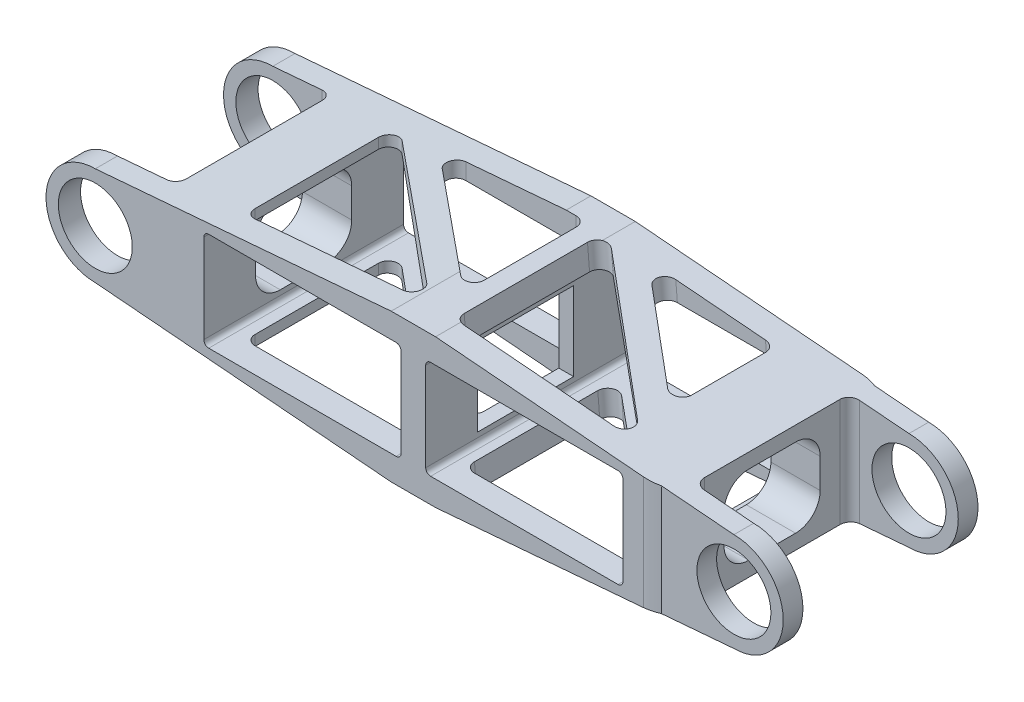
from build123d import *
from build123d.topology import SkipClean

# Parameters (mm, degrees)
ESQUISSE1_W                   = 150
ESQUISSE1_H                   = 30
BOSS_EXTRU_1_DEPTH            = 40.5
BOSS_EXTRU_2_DEPTH            = 40.5
ENL_V_MAT_EXTRU_2_DEPTH       = 173.526084984
ENL_V_START                   = -138
ESQUISSE4_W                   = 31.5
ESQUISSE4_H                   = 44.902895409
ENL_V_MAT_EXTRU_3_DEPTH       = 50
ENL_V_START_2                 = -50
ENL_V_MAT_EXTRU_4_DEPTH       = 50
ESQUISSE6_W                   = 40.808644438
ESQUISSE6_H                   = 31.212282358
ENL_V_MAT_EXTRU_5_DEPTH       = 0.5
ESQUISSE7_W                   = 30.686861219
ESQUISSE7_H                   = 47.66257168
ENL_V_MAT_EXTRU_6_DEPTH       = 0.5
ENL_V_MAT_EXTRU_7_DEPTH       = 168.750558866
CONG_1_R                      = 2
CONG_2_R                      = 10
ESQUISSE9_W                   = 19.5
ESQUISSE9_H                   = 16
ENL_V_MAT_EXTRU_8_DEPTH       = 147.915792208
ENL_V_MAT_EXTRU_9_DEPTH       = 169.654641001
CONG_4_R                      = 5
ENL_V_MAT_EXTRU_10_DEPTH      = 168.750558866
ENL_V_MAT_EXTRU_10_DEPTH_BACK = 168.750558866
ENL_V_MAT_EXTRU_11_DEPTH      = 168.750558866
ESQUISSE13_R                  = 7.5
ENL_V_MAT_EXTRU_12_DEPTH      = 168.750558908
ENL_V_MAT_EXTRU_13_DEPTH      = 168.750558908
ENL_V_START_3                 = -105
ESQUISSE15_W                  = 31.5
ESQUISSE15_H                  = 62.544521206
ENL_V_MAT_EXTRU_14_DEPTH      = 45
CONG_5_R                      = 2
CONG_6_R                      = 5


with BuildPart() as part:
    # Esquisse1 → Boss.-Extru.1 (new body)
    with BuildSketch(Plane.XY):
        with Locations((75, 15)):
            Rectangle(ESQUISSE1_W, ESQUISSE1_H)
    extrude(amount=BOSS_EXTRU_1_DEPTH)

    # Esquisse3 → Boss.-Extru.2 (add, through all)
    with BuildSketch(Plane.XY.offset(40.5)):
        with BuildLine():
            Line((150, 7.5), (150, 0))
            ThreePointArc((150, 0), (165, 15), (150, 30))
            Line((150, 30), (150, 22.5))
            ThreePointArc((150, 22.5), (155.303300859, 20.303300859), (157.5, 15))
            ThreePointArc((157.5, 15), (155.303300859, 9.696699141), (150, 7.5))
        make_face()
    extrude(amount=-BOSS_EXTRU_2_DEPTH)

    # Esquisse3<3> → Enlèv. mat.-Extru.2 (cut, through all)
    with SkipClean():  # the faces are left unmerged after this step: merging them gives an invalid solid
        with BuildSketch(Plane.XY.offset(40.5)):
            with BuildLine():
                Line((150, 22.5), (150, 7.5))
                ThreePointArc((150, 7.5), (155.303300859, 9.696699141), (157.5, 15))
                ThreePointArc((157.5, 15), (155.303300859, 20.303300859), (150, 22.5))
            make_face()
            with BuildLine():
                ThreePointArc((150, 22.5), (142.5, 15), (150, 7.5))
                Line((150, 7.5), (150, 22.5))
            make_face()
        extrude(amount=-ENL_V_MAT_EXTRU_2_DEPTH, mode=Mode.SUBTRACT)

    # Esquisse4 → Enlèv. mat.-Extru.3 (cut)
    with BuildSketch(Plane.ZY.offset(ENL_V_START)):
        with Locations((20.25, 16.046124804)):
            Rectangle(ESQUISSE4_W, ESQUISSE4_H)
    extrude(amount=-ENL_V_MAT_EXTRU_3_DEPTH, mode=Mode.SUBTRACT)

    # Esquisse5 → Enlèv. mat.-Extru.4 (cut)
    with BuildSketch(Plane(origin=(0, 0, 0), x_dir=(-1, 0, 0), z_dir=(0, 0, -1)).offset(ENL_V_START_2)):
        with BuildLine():
            Line((-90, 0), (-150, 5))
            ThreePointArc((-150, 5), (-160, 15), (-150, 25))
            Line((-150, 25), (-90, 30))
            Line((-90, 30), (-150, 30))
            ThreePointArc((-150, 30), (-165, 15), (-150, 0))
            Line((-150, 0), (-90, 0))
        make_face()
    extrude(amount=ENL_V_MAT_EXTRU_4_DEPTH, mode=Mode.SUBTRACT)

    # Esquisse6 → Enlèv. mat.-Extru.5 (cut)
    with BuildSketch(Plane(origin=(0, 0, 0), x_dir=(-1, 0, 0), z_dir=(0, 0, -1))):
        with Locations((-159.466318707, 17.991552194)):
            Rectangle(ESQUISSE6_W, ESQUISSE6_H)
    extrude(amount=-ENL_V_MAT_EXTRU_5_DEPTH, mode=Mode.SUBTRACT)

    # Esquisse7 → Enlèv. mat.-Extru.6 (cut)
    with BuildSketch(Plane.XY.offset(40.5)):
        with Locations((150.623308265, 11.626621639)):
            Rectangle(ESQUISSE7_W, ESQUISSE7_H)
    extrude(amount=-ENL_V_MAT_EXTRU_6_DEPTH, mode=Mode.SUBTRACT)

    # Esquisse8 → Enlèv. mat.-Extru.7 (cut, through all)
    with BuildSketch(Plane(origin=(0, 0, 0), x_dir=(-1, 0, 0), z_dir=(0, 0, -1))):
        with BuildLine():
            Line((-127, 5), (-89, 5))
            ThreePointArc((-89, 5), (-88.292893219, 5.292893219), (-88, 6))
            Line((-88, 6), (-88, 24))
            ThreePointArc((-88, 24), (-88.292893219, 24.707106781), (-89, 25))
            Line((-89, 25), (-127, 25))
            ThreePointArc((-127, 25), (-127.707106781, 24.707106781), (-128, 24))
            Line((-128, 24), (-128, 6))
            ThreePointArc((-128, 6), (-127.707106781, 5.292893219), (-127, 5))
        make_face()
    extrude(amount=-ENL_V_MAT_EXTRU_7_DEPTH, mode=Mode.SUBTRACT)

    # Congé1
    cong_1_edges = [part.edges().sort_by_distance(p)[0] for p in [
        (138, 15, 36),
        (138, 15, 4.5),
    ]]
    fillet(cong_1_edges, radius=CONG_1_R)

    # Congé2
    # the kernel refuses this fillet: 10 mm, written as the material it takes off along each edge
    with BuildSketch(Plane(origin=(139.061996488, -3.717747791, 0), x_dir=(-1, 0, 0), z_dir=(0, 1, 0))) as cong_2_piece_1:
        with BuildLine():
            CenterArc((3.122498999, 10), CONG_2_R, 251.805127661, 18.194872339)
            Line((0, 0.5), (-0.06244998, 0.31))
            ThreePointArc((-0.06244998, 0.31), (-0.2, 0.25), (-0.2, 0))
            Line((-0.2, 0), (0, -0.2))
            Line((0, -0.2), (3.122498999, -0.2))
            Line((3.122498999, -0.2), (3.122498999, 0))
        make_face()
    extrude(amount=37.435495581, mode=Mode.SUBTRACT)
    with BuildSketch(Plane(origin=(135.279877656, 34.03292436, 40.5), x_dir=(-2.2168933355567372e-12, 0, -1.0), z_dir=(0, -1, 0))) as cong_2_piece_2:
        with BuildLine():
            CenterArc((10, -3.122498999), CONG_2_R, 161.805127661, 18.194872339)
            Line((0, -3.122498999), (-0.2, -3.122498999))
            Line((-0.2, -3.122498999), (-0.2, 0))
            Line((-0.2, 0), (0, 0.2))
            ThreePointArc((0, 0.2), (0.25, 0.2), (0.31, 0.06244998))
            Line((0.31, 0.06244998), (0.5, 0))
        make_face()
    extrude(amount=38.06584872, mode=Mode.SUBTRACT)

    # Esquisse9 → Enlèv. mat.-Extru.8 (cut, through all)
    with BuildSketch(Plane(origin=(138, 0, 0), x_dir=(0, 0, -1), z_dir=(1, 0, 0))):
        with Locations((-20.25, 15)):
            Rectangle(ESQUISSE9_W, ESQUISSE9_H)
    extrude(amount=-ENL_V_MAT_EXTRU_8_DEPTH, mode=Mode.SUBTRACT)

    # Esquisse10 → Enlèv. mat.-Extru.9 (cut, through all)
    with BuildSketch(Plane(origin=(0.620689655, -7.448275862, 0), x_dir=(0.9965457582448797, 0.08304547985373982, 0), z_dir=(0.08304547985373982, -0.9965457582448797, 0))):
        with BuildLine():
            Line((121.973972493, 23.536442559), (103.973972493, 8.536442559))
            ThreePointArc((103.973972493, 8.536442559), (103.373798137, 6.319149472), (105.254341292, 5))
            Line((105.254341292, 5), (123.254341292, 5))
            ThreePointArc((123.254341292, 5), (124.668554855, 5.585786438), (125.254341292, 7))
            Line((125.254341292, 7), (125.254341292, 22))
            ThreePointArc((125.254341292, 22), (124.102652085, 23.811178842), (121.973972493, 23.536442559))
        make_face()
        with BuildLine():
            Line((124.276260675, 31.963557441), (94.276260675, 6.963557441))
            ThreePointArc((94.276260675, 6.963557441), (92.147581083, 6.688821158), (90.995891876, 8.5))
            Line((90.995891876, 8.5), (90.995891876, 33.5))
            ThreePointArc((90.995891876, 33.5), (91.581678313, 34.914213562), (92.995891876, 35.5))
            Line((92.995891876, 35.5), (122.995891876, 35.5))
            ThreePointArc((122.995891876, 35.5), (124.876435031, 34.180850528), (124.276260675, 31.963557441))
        make_face()
    extrude(amount=-ENL_V_MAT_EXTRU_9_DEPTH, mode=Mode.SUBTRACT)

    # Congé4
    cong_4_edges = [part.edges().sort_by_distance(p)[0] for p in [
        (133, 23, 10.5),
        (133, 7, 10.5),
        (133, 7, 30),
        (133, 23, 30),
    ]]
    fillet(cong_4_edges, radius=CONG_4_R)

    # Esquisse11 → Enlèv. mat.-Extru.10 (cut, two sides: drawn at the far end of the back side and taken through both)
    with BuildSketch(Plane(origin=(0, 0, 0), x_dir=(-1, 0, 0), z_dir=(0, 0, -1)).offset(-ENL_V_MAT_EXTRU_10_DEPTH_BACK)):
        with BuildLine():
            Line((-82, 5), (-44, 5))
            ThreePointArc((-44, 5), (-43.292893219, 5.292893219), (-43, 6))
            Line((-43, 6), (-43, 24))
            ThreePointArc((-43, 24), (-43.292893219, 24.707106781), (-44, 25))
            Line((-44, 25), (-82, 25))
            ThreePointArc((-82, 25), (-82.707106781, 24.707106781), (-83, 24))
            Line((-83, 24), (-83, 6))
            ThreePointArc((-83, 6), (-82.707106781, 5.292893219), (-82, 5))
        make_face()
    extrude(amount=ENL_V_MAT_EXTRU_10_DEPTH + ENL_V_MAT_EXTRU_10_DEPTH_BACK, mode=Mode.SUBTRACT)

    # Esquisse12 → Enlèv. mat.-Extru.11 (cut, through all)
    with BuildSketch(Plane.XZ):
        with BuildLine():
            Line((81.75012438, 27.165281701), (59.356069146, 8.503569006))
            ThreePointArc((59.356069146, 8.503569006), (58.761473804, 6.306887113), (60.624536078, 5))
            Line((60.624536078, 5), (83.018591312, 5))
            ThreePointArc((83.018591312, 5), (84.419658831, 5.580341169), (85, 6.981408688))
            Line((85, 6.981408688), (85, 25.643121383))
            ThreePointArc((85, 25.643121383), (83.859016499, 27.437464131), (81.75012438, 27.165281701))
        make_face()
        with BuildLine():
            Line((79.569697683, 31.85680085), (49.569697683, 6.85680085))
            ThreePointArc((49.569697683, 6.85680085), (47.441018091, 6.582064567), (46.289328883, 8.393243409))
            Line((46.289328883, 8.393243409), (46.289328883, 33.393243409))
            ThreePointArc((46.289328883, 33.393243409), (46.875115321, 34.807456972), (48.289328883, 35.393243409))
            Line((48.289328883, 35.393243409), (78.289328883, 35.393243409))
            ThreePointArc((78.289328883, 35.393243409), (80.169872039, 34.074093937), (79.569697683, 31.85680085))
        make_face()
    extrude(amount=-ENL_V_MAT_EXTRU_11_DEPTH, mode=Mode.SUBTRACT)

    # Esquisse13 → Enlèv. mat.-Extru.12 (cut, through all)
    with BuildSketch(Plane(origin=(0, 0, 0), x_dir=(-1, 0, 0), z_dir=(0, 0, -1))):
        with Locations((-21, 15)):
            Circle(ESQUISSE13_R)
    extrude(amount=-ENL_V_MAT_EXTRU_12_DEPTH, mode=Mode.SUBTRACT)

    # Esquisse14 → Enlèv. mat.-Extru.13 (cut, through all)
    with BuildSketch(Plane(origin=(0, 0, 0), x_dir=(-1, 0, 0), z_dir=(0, 0, -1))):
        with BuildLine():
            Line((-21, 5), (-81, 0))
            Line((-81, 0), (-81, -20.615224629))
            Line((-81, -20.615224629), (7.927190419, -20.615224629))
            Line((7.927190419, -20.615224629), (9.55194442, 56.956421391))
            Line((9.55194442, 56.956421391), (-81, 56.956421391))
            Line((-81, 56.956421391), (-81, 30))
            Line((-81, 30), (-21, 25))
            ThreePointArc((-21, 25), (-11, 15), (-21, 5))
        make_face()
    extrude(amount=-ENL_V_MAT_EXTRU_13_DEPTH, mode=Mode.SUBTRACT)

    # Esquisse15 → Enlèv. mat.-Extru.14 (cut)
    with BuildSketch(Plane(origin=(138, 0, 0), x_dir=(0, 0, -1), z_dir=(1, 0, 0)).offset(ENL_V_START_3)):
        with Locations((-20.25, 10.635611164)):
            Rectangle(ESQUISSE15_W, ESQUISSE15_H)
    extrude(amount=-ENL_V_MAT_EXTRU_14_DEPTH, mode=Mode.SUBTRACT)

    # Congé5
    cong_5_edges = [part.edges().sort_by_distance(p)[0] for p in [
        (33, 15, 4.5),
        (33, 15, 36),
    ]]
    fillet(cong_5_edges, radius=CONG_5_R)

    # Congé6
    cong_6_edges = [part.edges().sort_by_distance(p)[0] for p in [
        (38, 23, 30),
        (38, 23, 10.5),
        (38, 7, 10.5),
        (38, 7, 30),
    ]]
    fillet(cong_6_edges, radius=CONG_6_R)


solid = part.part
